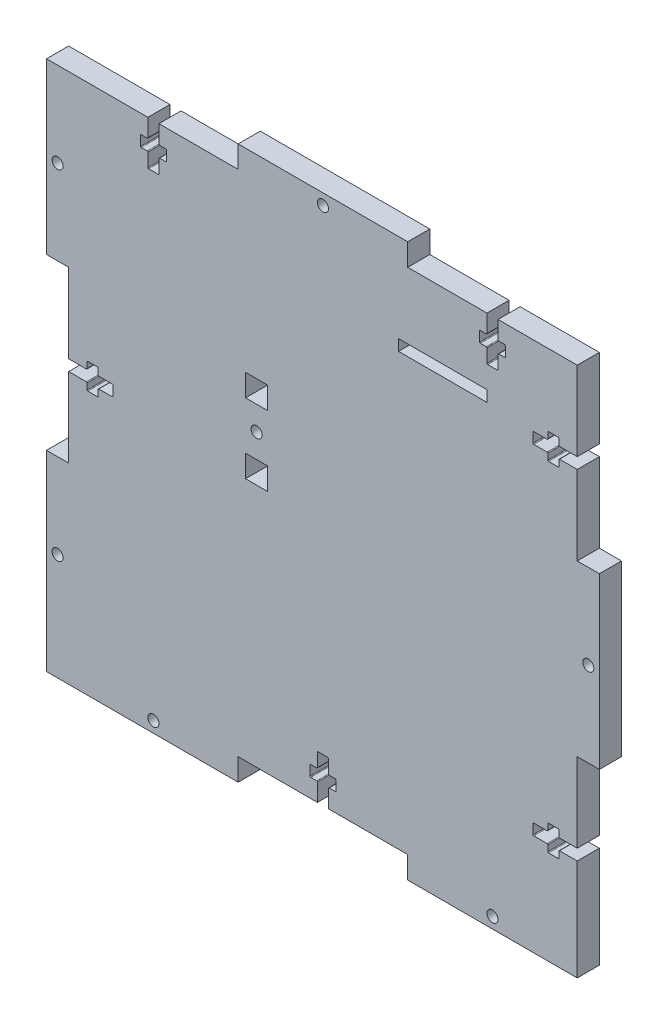
from build123d import *

# Parameters (mm, degrees)
BOX_SIDE_DEPTH       = 6
SKETCH2_R            = 1.5
SCREW_CUT_OUTS_DEPTH = 107.235587258
SKETCH3_R            = 1.5
SKETCH3_W            = 24
SKETCH3_H            = 3
SKETCH3_W_2          = 6
SKETCH3_H_2          = 6
GROOVES_DEPTH        = 107.235587258


with BuildPart() as part:
    # Sketch1 → Box Side (new body)
    with BuildSketch(Plane.XY):
        Polygon((-69, 69), (-23, 69), (-23, 75), (23, 75), (23, 69), (69, 69), (69, 23), (75, 23), (75, -23), (69, -23), (69, -69), (69, -75), (23, -75), (23, -69), (-23, -69), (-23, -75), (-69, -75), (-75, -75), (-75, -69), (-75, -23), (-69, -23), (-69, 23), (-75, 23), (-75, 69), align=None)
    extrude(amount=BOX_SIDE_DEPTH)

    # Sketch2 → Screw Cut-outs (cut, through all)
    with BuildSketch(Plane.XY.offset(6)):
        with Locations((0, 72)):
            Circle(SKETCH2_R)
        with Locations((72, 0)):
            Circle(SKETCH2_R)
        with Locations((-46, -72)):
            Circle(SKETCH2_R)
        with Locations((46, -72)):
            Circle(SKETCH2_R)
        with Locations((-72, 46)):
            Circle(SKETCH2_R)
        with Locations((-72, -46)):
            Circle(SKETCH2_R)
        with BuildLine():
            Line((-44.5, 69), (-44.5, 64.2))
            ThreePointArc((-44.5, 64.2), (-44.441421356, 64.058578644), (-44.3, 64))
            Line((-44.3, 64), (-42.7, 64))
            ThreePointArc((-42.7, 64), (-42.558578644, 63.941421356), (-42.5, 63.8))
            Line((-42.5, 63.8), (-42.5, 61.2))
            ThreePointArc((-42.5, 61.2), (-42.558578644, 61.058578644), (-42.7, 61))
            Line((-42.7, 61), (-44.3, 61))
            ThreePointArc((-44.3, 61), (-44.441421356, 60.941421356), (-44.5, 60.8))
            Line((-44.5, 60.8), (-44.5, 57.2))
            ThreePointArc((-44.5, 57.2), (-44.558578644, 57.058578644), (-44.7, 57))
            Line((-44.7, 57), (-47.3, 57))
            ThreePointArc((-47.3, 57), (-47.441421356, 57.058578644), (-47.5, 57.2))
            Line((-47.5, 57.2), (-47.5, 60.8))
            ThreePointArc((-47.5, 60.8), (-47.558578644, 60.941421356), (-47.7, 61))
            Line((-47.7, 61), (-49.3, 61))
            ThreePointArc((-49.3, 61), (-49.441421356, 61.058578644), (-49.5, 61.2))
            Line((-49.5, 61.2), (-49.5, 63.8))
            ThreePointArc((-49.5, 63.8), (-49.441421356, 63.941421356), (-49.3, 64))
            Line((-49.3, 64), (-47.7, 64))
            ThreePointArc((-47.7, 64), (-47.558578644, 64.058578644), (-47.5, 64.2))
            Line((-47.5, 64.2), (-47.5, 69))
            Line((-47.5, 69), (-44.5, 69))
        make_face()
        with BuildLine():
            Line((47.5, 69), (47.5, 64.2))
            ThreePointArc((47.5, 64.2), (47.558578644, 64.058578644), (47.7, 64))
            Line((47.7, 64), (49.3, 64))
            ThreePointArc((49.3, 64), (49.441421356, 63.941421356), (49.5, 63.8))
            Line((49.5, 63.8), (49.5, 61.2))
            ThreePointArc((49.5, 61.2), (49.441421356, 61.058578644), (49.3, 61))
            Line((49.3, 61), (47.7, 61))
            ThreePointArc((47.7, 61), (47.558578644, 60.941421356), (47.5, 60.8))
            Line((47.5, 60.8), (47.5, 57.2))
            ThreePointArc((47.5, 57.2), (47.441421356, 57.058578644), (47.3, 57))
            Line((47.3, 57), (44.7, 57))
            ThreePointArc((44.7, 57), (44.558578644, 57.058578644), (44.5, 57.2))
            Line((44.5, 57.2), (44.5, 60.8))
            ThreePointArc((44.5, 60.8), (44.441421356, 60.941421356), (44.3, 61))
            Line((44.3, 61), (42.7, 61))
            ThreePointArc((42.7, 61), (42.558578644, 61.058578644), (42.5, 61.2))
            Line((42.5, 61.2), (42.5, 63.8))
            ThreePointArc((42.5, 63.8), (42.558578644, 63.941421356), (42.7, 64))
            Line((42.7, 64), (44.3, 64))
            ThreePointArc((44.3, 64), (44.441421356, 64.058578644), (44.5, 64.2))
            Line((44.5, 64.2), (44.5, 69))
            Line((44.5, 69), (47.5, 69))
        make_face()
        with BuildLine():
            Line((69, 44.5), (64.2, 44.5))
            ThreePointArc((64.2, 44.5), (64.058578644, 44.441421356), (64, 44.3))
            Line((64, 44.3), (64, 42.7))
            ThreePointArc((64, 42.7), (63.941421356, 42.558578644), (63.8, 42.5))
            Line((63.8, 42.5), (61.2, 42.5))
            ThreePointArc((61.2, 42.5), (61.058578644, 42.558578644), (61, 42.7))
            Line((61, 42.7), (61, 44.3))
            ThreePointArc((61, 44.3), (60.941421356, 44.441421356), (60.8, 44.5))
            Line((60.8, 44.5), (57.2, 44.5))
            ThreePointArc((57.2, 44.5), (57.058578644, 44.558578644), (57, 44.7))
            Line((57, 44.7), (57, 47.3))
            ThreePointArc((57, 47.3), (57.058578644, 47.441421356), (57.2, 47.5))
            Line((57.2, 47.5), (60.8, 47.5))
            ThreePointArc((60.8, 47.5), (60.941421356, 47.558578644), (61, 47.7))
            Line((61, 47.7), (61, 49.3))
            ThreePointArc((61, 49.3), (61.058578644, 49.441421356), (61.2, 49.5))
            Line((61.2, 49.5), (63.8, 49.5))
            ThreePointArc((63.8, 49.5), (63.941421356, 49.441421356), (64, 49.3))
            Line((64, 49.3), (64, 47.7))
            ThreePointArc((64, 47.7), (64.058578644, 47.558578644), (64.2, 47.5))
            Line((64.2, 47.5), (69, 47.5))
            Line((69, 47.5), (69, 44.5))
        make_face()
        with BuildLine():
            Line((69, -47.5), (64.2, -47.5))
            ThreePointArc((64.2, -47.5), (64.058578644, -47.558578644), (64, -47.7))
            Line((64, -47.7), (64, -49.3))
            ThreePointArc((64, -49.3), (63.941421356, -49.441421356), (63.8, -49.5))
            Line((63.8, -49.5), (61.2, -49.5))
            ThreePointArc((61.2, -49.5), (61.058578644, -49.441421356), (61, -49.3))
            Line((61, -49.3), (61, -47.7))
            ThreePointArc((61, -47.7), (60.941421356, -47.558578644), (60.8, -47.5))
            Line((60.8, -47.5), (57.2, -47.5))
            ThreePointArc((57.2, -47.5), (57.058578644, -47.441421356), (57, -47.3))
            Line((57, -47.3), (57, -44.7))
            ThreePointArc((57, -44.7), (57.058578644, -44.558578644), (57.2, -44.5))
            Line((57.2, -44.5), (60.8, -44.5))
            ThreePointArc((60.8, -44.5), (60.941421356, -44.441421356), (61, -44.3))
            Line((61, -44.3), (61, -42.7))
            ThreePointArc((61, -42.7), (61.058578644, -42.558578644), (61.2, -42.5))
            Line((61.2, -42.5), (63.8, -42.5))
            ThreePointArc((63.8, -42.5), (63.941421356, -42.558578644), (64, -42.7))
            Line((64, -42.7), (64, -44.3))
            ThreePointArc((64, -44.3), (64.058578644, -44.441421356), (64.2, -44.5))
            Line((64.2, -44.5), (69, -44.5))
            Line((69, -44.5), (69, -47.5))
        make_face()
        with BuildLine():
            Line((-1.5, -69), (1.5, -69))
            Line((1.5, -69), (1.5, -64.2))
            ThreePointArc((1.5, -64.2), (1.558578644, -64.058578644), (1.7, -64))
            Line((1.7, -64), (3.3, -64))
            ThreePointArc((3.3, -64), (3.441421356, -63.941421356), (3.5, -63.8))
            Line((3.5, -63.8), (3.5, -61.2))
            ThreePointArc((3.5, -61.2), (3.441421356, -61.058578644), (3.3, -61))
            Line((3.3, -61), (1.7, -61))
            ThreePointArc((1.7, -61), (1.558578644, -60.941421356), (1.5, -60.8))
            Line((1.5, -60.8), (1.5, -57.2))
            ThreePointArc((1.5, -57.2), (1.441421356, -57.058578644), (1.3, -57))
            Line((1.3, -57), (-1.3, -57))
            ThreePointArc((-1.3, -57), (-1.441421356, -57.058578644), (-1.5, -57.2))
            Line((-1.5, -57.2), (-1.5, -60.8))
            ThreePointArc((-1.5, -60.8), (-1.558578644, -60.941421356), (-1.7, -61))
            Line((-1.7, -61), (-3.3, -61))
            ThreePointArc((-3.3, -61), (-3.441421356, -61.058578644), (-3.5, -61.2))
            Line((-3.5, -61.2), (-3.5, -63.8))
            ThreePointArc((-3.5, -63.8), (-3.441421356, -63.941421356), (-3.3, -64))
            Line((-3.3, -64), (-1.7, -64))
            ThreePointArc((-1.7, -64), (-1.558578644, -64.058578644), (-1.5, -64.2))
            Line((-1.5, -64.2), (-1.5, -69))
        make_face()
        with BuildLine():
            Line((-69, -1.5), (-64.2, -1.5))
            ThreePointArc((-64.2, -1.5), (-64.058578644, -1.558578644), (-64, -1.7))
            Line((-64, -1.7), (-64, -3.3))
            ThreePointArc((-64, -3.3), (-63.941421356, -3.441421356), (-63.8, -3.5))
            Line((-63.8, -3.5), (-61.2, -3.5))
            ThreePointArc((-61.2, -3.5), (-61.058578644, -3.441421356), (-61, -3.3))
            Line((-61, -3.3), (-61, -1.7))
            ThreePointArc((-61, -1.7), (-60.941421356, -1.558578644), (-60.8, -1.5))
            Line((-60.8, -1.5), (-57.2, -1.5))
            ThreePointArc((-57.2, -1.5), (-57.058578644, -1.441421356), (-57, -1.3))
            Line((-57, -1.3), (-57, 1.3))
            ThreePointArc((-57, 1.3), (-57.058578644, 1.441421356), (-57.2, 1.5))
            Line((-57.2, 1.5), (-60.8, 1.5))
            ThreePointArc((-60.8, 1.5), (-60.941421356, 1.558578644), (-61, 1.7))
            Line((-61, 1.7), (-61, 3.3))
            ThreePointArc((-61, 3.3), (-61.058578644, 3.441421356), (-61.2, 3.5))
            Line((-61.2, 3.5), (-63.8, 3.5))
            ThreePointArc((-63.8, 3.5), (-63.941421356, 3.441421356), (-64, 3.3))
            Line((-64, 3.3), (-64, 1.7))
            ThreePointArc((-64, 1.7), (-64.058578644, 1.558578644), (-64.2, 1.5))
            Line((-64.2, 1.5), (-69, 1.5))
            Line((-69, 1.5), (-69, -1.5))
        make_face()
    extrude(amount=-SCREW_CUT_OUTS_DEPTH, mode=Mode.SUBTRACT)

    # Sketch3 → Grooves (cut, through all)
    with BuildSketch(Plane.XY.offset(6)):
        with Locations((-18, 9.82)):
            Circle(SKETCH3_R)
        with Locations((32.5, 49.5)):
            Rectangle(SKETCH3_W, SKETCH3_H)
        with Locations((-18, 19.32)):
            Rectangle(SKETCH3_W_2, SKETCH3_H_2)
        with Locations((-18, 0.32)):
            Rectangle(SKETCH3_W_2, SKETCH3_H_2)
    extrude(amount=-GROOVES_DEPTH, mode=Mode.SUBTRACT)


solid = part.part
